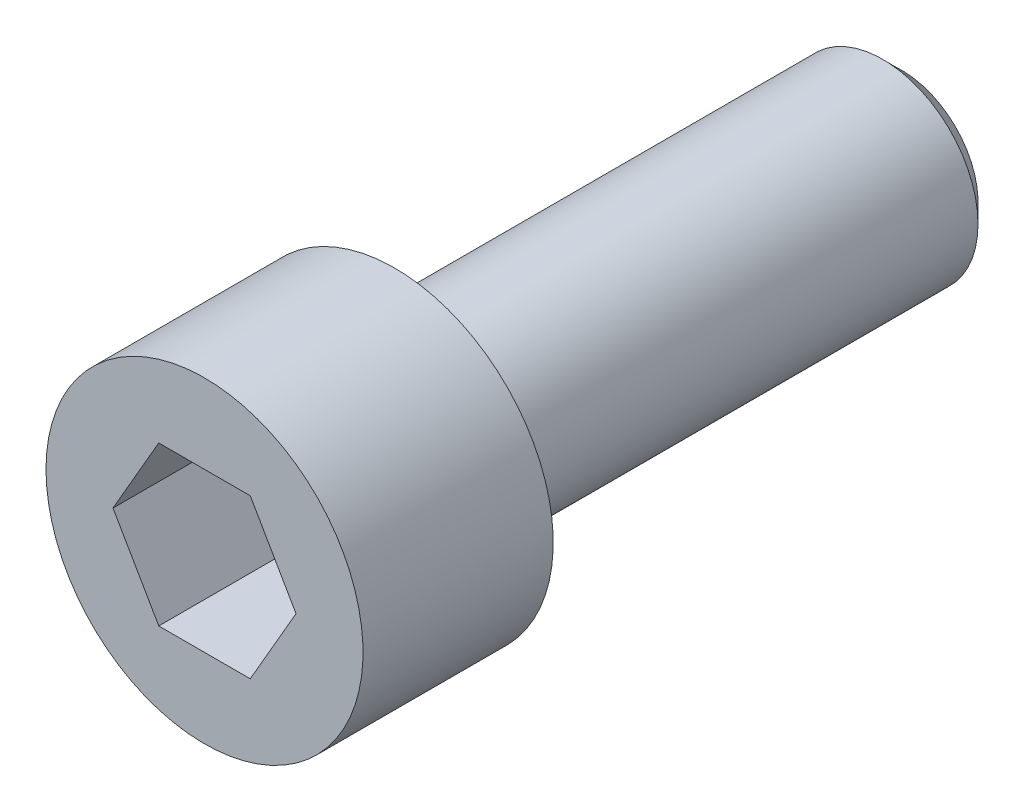
from build123d import *

# Parameters (mm, degrees)
CUT_EXTRUDE_1_DEPTH = 2
FILLET_1_R          = 0.3
CHAMFER_1_SIZE      = 0.3


with BuildPart() as part:
    # Эскиз1 → Повернуть1 (revolve)
    with BuildSketch(Plane(origin=(0, 0, 0), x_dir=(0, 0, -1), z_dir=(1, 0, 0))):
        Polygon((0, 0), (0, 2.5), (3, 2.5), (3, 1.5), (11, 1.5), (11, 0), align=None)
    revolve(axis=Axis((0, 0, 0), (0, 0, 1)))

    # Эскиз2 → Вырез-Вытянуть1 (cut)
    with BuildSketch(Plane.XY):
        Polygon((1.443375673, 0), (0.721687836, 1.25), (-0.721687836, 1.25), (-1.443375673, 0), (-0.721687836, -1.25), (0.721687836, -1.25), align=None)
    extrude(amount=-CUT_EXTRUDE_1_DEPTH, mode=Mode.SUBTRACT)

    # Скругление1
    fillet_1_edges = [part.edges().sort_by_distance(p)[0] for p in [
        (0, -1.5, -3),
    ]]
    fillet(fillet_1_edges, radius=FILLET_1_R)

    # Фаска1
    chamfer_1_edges = [part.edges().sort_by_distance(p)[0] for p in [
        (0, -1.5, -11),
    ]]
    chamfer(chamfer_1_edges, length=CHAMFER_1_SIZE)


solid = part.part
